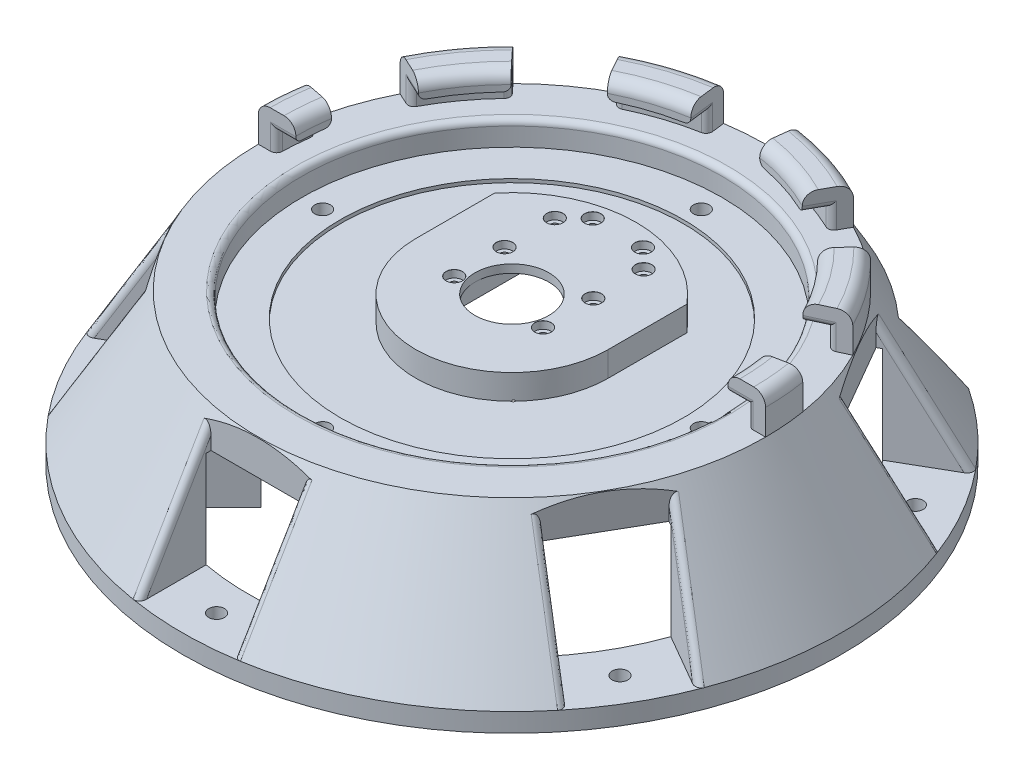
from build123d import *

# Parameters (mm, degrees)
SKETCH2_R                       = 12.5
CUT_EXTRUDE1_DEPTH              = 171.457229262
SKETCH3_R                       = 71
CUT_EXTRUDE2_DEPTH              = 8.2
CUT_EXTRUDE5_DEPTH              = 39
SKETCH8_W                       = 31.75
SKETCH8_H                       = 38.1
CUT_EXTRUDE6_DEPTH              = 44.45
CIRPATTERN2_COUNT               = 6
SKETCH9_R                       = 2.649982
CUT_EXTRUDE7_DEPTH              = 171.457229262
CIRPATTERN3_COUNT               = 6
REVOLVE2_ANGLE                  = 180
CUT_EXTRUDE9_DEPTH              = 12.7
SKETCH3_3_R                     = 12.5
CUT_EXTRUDE11_DEPTH             = 1
CBORE_FOR_M2_5_SHCS1_AT_2_COUNT = 2
CBORE_FOR_M2_5_SHCS1_AT_2_PITCH = 17
CBORE_FOR_M2_5_SHCS1_AT_3_COUNT = 2
CBORE_FOR_M2_5_SHCS1_AT_3_PITCH = 34
CBORE_FOR_M2_5_SHCS1_AT_4_COUNT = 2
CBORE_FOR_M2_5_SHCS1_AT_4_PITCH = 40.820828017
CBORE_FOR_M2_5_SHCS1_AT_5_COUNT = 2
CBORE_FOR_M2_5_SHCS1_AT_5_PITCH = 46.651259361
CBORE_FOR_M2_5_SHCS1_AT_6_COUNT = 2
CBORE_FOR_M2_5_SHCS1_AT_6_PITCH = 45.343136195
CBORE_FOR_M2_5_SHCS1_AT_7_COUNT = 2
CBORE_FOR_M2_5_SHCS1_AT_7_PITCH = 34.481879299
CBORE_FOR_M2_5_SHCS1_AT_8_COUNT = 2
CBORE_FOR_M2_5_SHCS1_AT_8_PITCH = 30
FILLET1_R                       = 4
FILLET2_R                       = 2
FILLET3_R                       = 2
FILLET4_R                       = 2
FILLET5_R                       = 2
FILLET9_R                       = 1
CUT_EXTRUDE12_DEPTH             = 8.05
CUT_EXTRUDE15_START             = -2.75
SKETCH20_R                      = 1.45
CUT_EXTRUDE15_DEPTH             = 2.75
M5_CLEARANCE_HOLE1_D            = 5.3
SKETCH34_R                      = 58
CUT_EXTRUDE16_DEPTH             = 1.2
BOSS_EXTRUDE1_DEPTH             = 39
FILLET10_R                      = 10
SKETCH37_R                      = 121.388219465
SKETCH37_R_2                    = 111.388219465
CUT_EXTRUDE_THIN1_DEPTH         = 171.457229427


with BuildPart() as part:
    # Sketch1 → Revolve1 (revolve)
    with BuildSketch(Plane.XY, mode=Mode.PRIVATE) as revolve1_sk:
        Polygon((0, 0), (-85.725, 0), (-115.054393675, -50.8), (0, -50.8), align=None)
    revolve(revolve1_sk.sketch.rotate(Axis((0, 0, 0), (0, -1, 0)), 270), axis=Axis((0, 0, 0), (0, -1, 0)))

    # Sketch2 → Cut-Extrude1 (cut, through all)
    with BuildSketch(Plane(origin=(0, 0, 0), x_dir=(1, 0, 0), z_dir=(0, 1, 0))):
        with Locations(Location((0, 0, 0), (0, 0, 270))):
            Circle(SKETCH2_R)
    extrude(amount=-CUT_EXTRUDE1_DEPTH, mode=Mode.SUBTRACT)

    # Sketch3 → Cut-Extrude2 (cut)
    with BuildSketch(Plane(origin=(0, 0, 0), x_dir=(1, 0, 0), z_dir=(0, 1, 0))):
        with Locations(Location((0, 0, 0), (0, 0, 270))):
            Circle(SKETCH3_R)
        with BuildLine():
            ThreePointArc((32.5, 0), (0, -32.5), (-32.5, 0))
            Line((-32.5, 0), (-32.5, 26.603571189))
            ThreePointArc((-32.5, 26.603571189), (0, 42), (32.5, 26.603571189))
            Line((32.5, 26.603571189), (32.5, 0))
        make_face(mode=Mode.SUBTRACT)
    extrude(amount=-CUT_EXTRUDE2_DEPTH, mode=Mode.SUBTRACT)

    # Sketch7 → Cut-Extrude5 (cut)
    with BuildSketch(Plane.XZ.offset(50.8)):
        with BuildLine():
            Line((-60, -65.598856697), (-60, -161.1))
            Line((-60, -161.1), (60, -161.1))
            Line((60, -161.1), (60, -65.598856697))
            ThreePointArc((60, -65.598856697), (0, 88.9), (-60, -65.598856697))
        make_face()
    extrude(amount=-CUT_EXTRUDE5_DEPTH, mode=Mode.SUBTRACT)

    # Sketch8 → Cut-Extrude6 (cut)
    with BuildSketch(Plane(origin=(0, 0, 0), x_dir=(1, 0, 0), z_dir=(0, 1, 0))):
        with Locations((0, -104.875)):
            Rectangle(SKETCH8_W, SKETCH8_H)
    cut_extrude6 = extrude(amount=-CUT_EXTRUDE6_DEPTH, mode=Mode.SUBTRACT)

    # CirPattern2: Cut-Extrude6 ×6 about axis, 1 skipped
    cirpattern2_axis = Axis((0, 0, 0), (0, -1, 0))
    add([cut_extrude6.rotate(cirpattern2_axis, i * 360 / CIRPATTERN2_COUNT) for i in range(1, CIRPATTERN2_COUNT) if i not in (3,)], mode=Mode.SUBTRACT)

    # Sketch9 → Cut-Extrude7 (cut, through all)
    with BuildSketch(Plane(origin=(0, 0, 0), x_dir=(1, 0, 0), z_dir=(0, 1, 0))):
        with Locations(Location((0, -99.814393675, 0), (0, 0, 270))):
            Circle(SKETCH9_R)
    cut_extrude7 = extrude(amount=-CUT_EXTRUDE7_DEPTH, mode=Mode.SUBTRACT)

    # CirPattern3: Cut-Extrude7 ×6 about axis
    cirpattern3_axis = Axis((0, 0, 0), (0, 1, 0))
    for i in range(1, CIRPATTERN3_COUNT):
        add(cut_extrude7.rotate(cirpattern3_axis, i * 360 / CIRPATTERN3_COUNT), mode=Mode.SUBTRACT)

    # Sketch12 → Revolve2 (revolve)
    with BuildSketch(Plane.XY):
        Polygon((85.725, 0), (85.725, 12.7), (73.025, 12.7), (73.025, 6.55), (79.575, 6.55), (79.575, 0), align=None)
    revolve(axis=Axis((0, 0, 0), (0, 1, 0)), revolution_arc=REVOLVE2_ANGLE)

    # Sketch18 → Cut-Extrude9 (cut)
    with BuildSketch(Plane(origin=(0, 12.7, 0), x_dir=(1, 0, 0), z_dir=(0, 1, 0))):
        Polygon((46.643270314, 89.718478222), (70.913780145, 72.084920653), (36.670415564, 35.160782448), (22.108109665, 45.740916989), align=None)
        Polygon((-15, 100), (-9, 50), (9, 50), (15, 100), align=None)
        Polygon((90.470396714, 45.167547182), (99.740906545, 16.635851693), (50.333978764, 6.891341072), (44.771672865, 24.010358365), align=None)
        Polygon((99.740906545, -16.635851693), (90.470396714, -45.167547182), (44.771672865, -24.010358365), (50.333978764, -6.891341072), align=None)
        Polygon((70.913780145, -72.084920653), (46.643270314, -89.718478222), (22.108109665, -45.740916989), (36.670415564, -35.160782448), align=None)
        Polygon((15, -100), (-15, -100), (-9, -50), (9, -50), align=None)
        Polygon((-46.643270314, -89.718478222), (-70.913780145, -72.084920653), (-36.670415564, -35.160782448), (-22.108109665, -45.740916989), align=None)
        Polygon((-90.470396714, -45.167547182), (-99.740906545, -16.635851693), (-50.333978764, -6.891341072), (-44.771672865, -24.010358365), align=None)
        Polygon((-99.740906545, 16.635851693), (-90.470396714, 45.167547182), (-44.771672865, 24.010358365), (-50.333978764, 6.891341072), align=None)
        Polygon((-70.913780145, 72.084920653), (-46.643270314, 89.718478222), (-22.108109665, 45.740916989), (-36.670415564, 35.160782448), align=None)
    extrude(amount=-CUT_EXTRUDE9_DEPTH, mode=Mode.SUBTRACT)

    # Sketch3<3> → Cut-Extrude11 (cut)
    # profile 1 of 5: a face of its own
    with BuildSketch(Plane(origin=(0, 0, 0), x_dir=(1, 0, 0), z_dir=(0, 1, 0))):
        with BuildLine():
            ThreePointArc((-18.668154703, 26.603571189), (-28.835438507, 14.992247533), (-32.5, 0))
            ThreePointArc((-32.5, 0), (0, -32.5), (32.5, 0))
            ThreePointArc((32.5, 0), (28.835438507, 14.992247533), (18.668154703, 26.603571189))
            Line((18.668154703, 26.603571189), (-18.668154703, 26.603571189))
        make_face()
        with Locations(Location((0, 0, 0), (0, 0, 270))):
            Circle(SKETCH3_3_R, mode=Mode.SUBTRACT)
    # profile 2 of 5: a face of its own
    with BuildSketch(Plane(origin=(0, 0, 0), x_dir=(1, 0, 0), z_dir=(0, 1, 0))):
        with BuildLine():
            Line((-32.5, 26.603571189), (-32.5, 0))
            ThreePointArc((-32.5, 0), (-28.835438507, 14.992247533), (-18.668154703, 26.603571189))
            Line((-18.668154703, 26.603571189), (-32.5, 26.603571189))
        make_face()
    # profile 3 of 5: a face of its own
    with BuildSketch(Plane(origin=(0, 0, 0), x_dir=(1, 0, 0), z_dir=(0, 1, 0))):
        with BuildLine():
            ThreePointArc((18.668154703, 26.603571189), (0, 32.5), (-18.668154703, 26.603571189))
            Line((-18.668154703, 26.603571189), (18.668154703, 26.603571189))
        make_face()
    # profile 4 of 5: a face of its own
    with BuildSketch(Plane(origin=(0, 0, 0), x_dir=(1, 0, 0), z_dir=(0, 1, 0))):
        with BuildLine():
            ThreePointArc((32.5, 26.603571189), (0, 42), (-32.5, 26.603571189))
            Line((-32.5, 26.603571189), (-18.668154703, 26.603571189))
            ThreePointArc((-18.668154703, 26.603571189), (0, 32.5), (18.668154703, 26.603571189))
            Line((18.668154703, 26.603571189), (32.5, 26.603571189))
        make_face()
    # profile 5 of 5: a face of its own
    with BuildSketch(Plane(origin=(0, 0, 0), x_dir=(1, 0, 0), z_dir=(0, 1, 0))):
        with BuildLine():
            ThreePointArc((18.668154703, 26.603571189), (28.835438507, 14.992247533), (32.5, 0))
            Line((32.5, 0), (32.5, 26.603571189))
            Line((32.5, 26.603571189), (18.668154703, 26.603571189))
        make_face()
    extrude(amount=-CUT_EXTRUDE11_DEPTH, mode=Mode.SUBTRACT)

    # Sketch24 → CBORE for M2.5 SHCS1 (revolve, cut)
    with BuildSketch(Plane(origin=(-15, -1, 4.5), x_dir=(0, 0, 1), z_dir=(1, 0, 0))):
        Polygon((0, 0), (0, 49.8), (1.45, 49.8), (1.45, 2.5), (2.75, 2.5), (2.75, 0.025), (2.775, 0), align=None)
    cbore_for_m2_5_shcs1 = revolve(axis=Axis((-15, 5.35, 4.5), (0, -1, 0)), mode=Mode.SUBTRACT)

    # CBORE for M2.5 SHCS1 at 2: CBORE for M2.5 SHCS1 ×2
    with Locations(*[(0, 0, -i * CBORE_FOR_M2_5_SHCS1_AT_2_PITCH) for i in range(1, CBORE_FOR_M2_5_SHCS1_AT_2_COUNT)]):
        add(cbore_for_m2_5_shcs1, mode=Mode.SUBTRACT)

    # CBORE for M2.5 SHCS1 at 3: CBORE for M2.5 SHCS1 ×2
    with Locations(*[(0, 0, -i * CBORE_FOR_M2_5_SHCS1_AT_3_PITCH) for i in range(1, CBORE_FOR_M2_5_SHCS1_AT_3_COUNT)]):
        add(cbore_for_m2_5_shcs1, mode=Mode.SUBTRACT)

    # CBORE for M2.5 SHCS1 at 4: CBORE for M2.5 SHCS1 ×2
    with Locations(*[Vector(0.15923243882462063, 0, -0.9872411207126472) * (i * CBORE_FOR_M2_5_SHCS1_AT_4_PITCH) for i in range(1, CBORE_FOR_M2_5_SHCS1_AT_4_COUNT)]):
        add(cbore_for_m2_5_shcs1, mode=Mode.SUBTRACT)

    # CBORE for M2.5 SHCS1 at 5: CBORE for M2.5 SHCS1 ×2
    with Locations(*[Vector(0.5037377408822789, 0, -0.8638566364917376) * (i * CBORE_FOR_M2_5_SHCS1_AT_5_PITCH) for i in range(1, CBORE_FOR_M2_5_SHCS1_AT_5_COUNT)]):
        add(cbore_for_m2_5_shcs1, mode=Mode.SUBTRACT)

    # CBORE for M2.5 SHCS1 at 6: CBORE for M2.5 SHCS1 ×2
    with Locations(*[Vector(0.6616216370868465, 0, -0.7498378553650925) * (i * CBORE_FOR_M2_5_SHCS1_AT_6_PITCH) for i in range(1, CBORE_FOR_M2_5_SHCS1_AT_6_COUNT)]):
        add(cbore_for_m2_5_shcs1, mode=Mode.SUBTRACT)

    # CBORE for M2.5 SHCS1 at 7: CBORE for M2.5 SHCS1 ×2
    with Locations(*[Vector(0.8700221858486125, 0, -0.4930125719808802) * (i * CBORE_FOR_M2_5_SHCS1_AT_7_PITCH) for i in range(1, CBORE_FOR_M2_5_SHCS1_AT_7_COUNT)]):
        add(cbore_for_m2_5_shcs1, mode=Mode.SUBTRACT)

    # CBORE for M2.5 SHCS1 at 8: CBORE for M2.5 SHCS1 ×2
    with Locations(*[(i * CBORE_FOR_M2_5_SHCS1_AT_8_PITCH, 0, 0) for i in range(1, CBORE_FOR_M2_5_SHCS1_AT_8_COUNT)]):
        add(cbore_for_m2_5_shcs1, mode=Mode.SUBTRACT)

    # Fillet1
    fillet1_edges = [part.edges().sort_by_distance(p)[0] for p in [
        (-85.450905057, 12.7, -6.849704366),
        (-72.808821363, 12.7, -5.614815819),
        (-59.078466014, 12.7, -42.923018049),
        (-22.565966014, 12.7, -69.450902102),
        (22.565966014, 12.7, -69.450902102),
        (59.078466014, 12.7, -42.923018049),
        (72.808821363, 12.7, -5.614815819),
        (-69.352981843, 12.7, -50.387890753),
        (-26.490481843, 12.7, -81.529319859),
        (26.490481843, 12.7, -81.529319859),
        (69.352981843, 12.7, -50.387890753),
        (85.450905057, 12.7, -6.849704365),
    ]]
    fillet(fillet1_edges, radius=FILLET1_R)

    # Fillet2
    fillet2_edges = [part.edges().sort_by_distance(p)[0] for p in [
        (-76.3, 6.55, 0),
        (76.3, 6.55, 0),
        (67.935220856, 6.55, -34.734411845),
        (75.377123218, 6.55, -11.830591458),
        (34.544373159, 6.55, -68.032050402),
        (54.027526486, 6.55, -53.876710931),
        (-75.377123218, 6.55, -11.830591458),
        (-67.935220856, 6.55, -34.734411845),
        (-54.027526486, 6.55, -53.876710931),
        (-34.544373159, 6.55, -68.032050402),
        (12.041250964, 6.55, -75.34375803),
        (-12.041250964, 6.55, -75.34375803),
    ]]
    fillet(fillet2_edges, radius=FILLET2_R)

    # Fillet3
    fillet3_edges = [part.edges().sort_by_distance(p)[0] for p in [
        (-78.59268106, 4.275, -12.464794776),
        (-56.256192069, 4.275, -56.279849671),
        (-70.909437153, 4.275, -36.11138806),
        (-12.431749785, 4.275, -78.597914872),
        (56.256192069, 4.275, -56.279849671),
        (78.59268106, 4.275, -12.464794776),
        (-79.575, 4.275, 0),
        (-36.141198377, 4.275, -70.894248038),
        (12.431749785, 4.275, -78.597914872),
        (36.141198377, 4.275, -70.894248038),
        (70.909437153, 4.275, -36.11138806),
        (79.575, 4.275, 0),
    ]]
    fillet(fillet3_edges, radius=FILLET3_R)

    # Fillet4
    fillet4_edges = [part.edges().sort_by_distance(p)[0] for p in [
        (92.853698409, -23.56380487, 35.278236725),
        (76.978698409, -23.56380487, 62.774543295),
        (76.978698409, -23.56380487, -62.774543295),
        (92.853698409, -23.56380487, -35.278236725),
        (-92.853698409, -23.56380487, -35.278236725),
        (-76.978698409, -23.56380487, -62.774543295),
        (-76.978698409, -23.56380487, 62.774543295),
        (-92.853698409, -23.56380487, 35.278236725),
        (15.875, -23.56380487, 98.05278002),
        (-15.875, -23.56380487, 98.05278002),
    ]]
    fillet(fillet4_edges, radius=FILLET4_R)

    # Fillet5
    fillet5_edges = [part.edges().sort_by_distance(p)[0] for p in [
        (0, 0, -71),
    ]]
    fillet(fillet5_edges, radius=FILLET5_R)

    # Fillet9
    fillet9_edges = [part.edges().sort_by_distance(p)[0] for p in [
        (-60, -31.116866881, -84.56763471),
        (60, -31.116866881, -84.56763471),
    ]]
    fillet(fillet9_edges, radius=FILLET9_R)

    # Sketch28 → Cut-Extrude12 (cut)
    with BuildSketch(Plane.XZ.offset(11.8)):
        with BuildLine():
            Line((9.2, 12.5), (-9.2, 12.5))
            ThreePointArc((-9.2, 12.5), (-11.674873734, 11.474873734), (-12.7, 9))
            Line((-12.7, 9), (-12.7, -30))
            ThreePointArc((-12.7, -30), (-11.674873734, -32.474873734), (-9.2, -33.5))
            Line((-9.2, -33.5), (9.2, -33.5))
            ThreePointArc((9.2, -33.5), (11.674873734, -32.474873734), (12.7, -30))
            Line((12.7, -30), (12.7, 9))
            ThreePointArc((12.7, 9), (11.674873734, 11.474873734), (9.2, 12.5))
        make_face()
    extrude(amount=-CUT_EXTRUDE12_DEPTH, mode=Mode.SUBTRACT)

    # Sketch20 → Cut-Extrude15 (cut)
    with BuildSketch(Plane.XZ.offset(11.8).offset(CUT_EXTRUDE15_START)):
        Polygon((-22.5, 23), (-22.5, -33), (-12.5, -40), (13.5, -40), (23.5, -33), (23.5, 23), align=None)
        with Locations(Location((-15, -29.5, 0), (0, 0, 90))):
            Circle(SKETCH20_R, mode=Mode.SUBTRACT)
        with Locations(Location((-8.5, -35.8, 0), (0, 0, 90))):
            Circle(SKETCH20_R, mode=Mode.SUBTRACT)
        with Locations(Location((-15, -12.5, 0), (0, 0, 90))):
            Circle(SKETCH20_R, mode=Mode.SUBTRACT)
        with Locations(Location((8.5, -35.8, 0), (0, 0, 90))):
            Circle(SKETCH20_R, mode=Mode.SUBTRACT)
        with Locations(Location((15, -29.5, 0), (0, 0, 90))):
            Circle(SKETCH20_R, mode=Mode.SUBTRACT)
        with BuildLine():
            ThreePointArc((-12.7, 9), (-11.674873734, 11.474873734), (-9.2, 12.5))
            Line((-9.2, 12.5), (9.2, 12.5))
            ThreePointArc((9.2, 12.5), (11.674873734, 11.474873734), (12.7, 9))
            Line((12.7, 9), (12.7, -30))
            ThreePointArc((12.7, -30), (11.674873734, -32.474873734), (9.2, -33.5))
            Line((9.2, -33.5), (-9.2, -33.5))
            ThreePointArc((-9.2, -33.5), (-11.674873734, -32.474873734), (-12.7, -30))
            Line((-12.7, -30), (-12.7, 9))
        make_face(mode=Mode.SUBTRACT)
        with Locations(Location((15, -12.5, 0), (0, 0, 90))):
            Circle(SKETCH20_R, mode=Mode.SUBTRACT)
        with Locations(Location((-15, 4.5, 0), (0, 0, 90))):
            Circle(SKETCH20_R, mode=Mode.SUBTRACT)
        with Locations(Location((15, 4.5, 0), (0, 0, 90))):
            Circle(SKETCH20_R, mode=Mode.SUBTRACT)
    extrude(amount=CUT_EXTRUDE15_DEPTH, mode=Mode.SUBTRACT)

    # M5 Clearance Hole1 (through all)
    with Locations(Plane(origin=(0, -8.2, 0), x_dir=(1, 0, 0), z_dir=(0, 1, 0))):
        with Locations((0, 64), (64, 0), (0, -64), (-64, 0)):
            Hole(M5_CLEARANCE_HOLE1_D / 2)

    # Sketch34 → Cut-Extrude16 (cut)
    with BuildSketch(Plane(origin=(0, -8.2, 0), x_dir=(1, 0, 0), z_dir=(0, 1, 0))):
        with Locations(Location((0, 0, 0), (0, 0, 270))):
            Circle(SKETCH34_R)
        with BuildLine():
            ThreePointArc((32.5, 0), (0, -32.5), (-32.5, 0))
            Line((-32.5, 0), (-32.5, 26.603571189))
            ThreePointArc((-32.5, 26.603571189), (0, 42), (32.5, 26.603571189))
            Line((32.5, 26.603571189), (32.5, 0))
        make_face(mode=Mode.SUBTRACT)
    extrude(amount=-CUT_EXTRUDE16_DEPTH, mode=Mode.SUBTRACT)

    # Sketch39 → Boss-Extrude1 (add)
    with BuildSketch(Plane.XZ.offset(50.8)):
        with BuildLine():
            ThreePointArc((-48.831845645, 74.287689767), (-56.138266806, 68.932612021), (-62.861792847, 62.861792847))
            Line((-62.861792847, 62.861792847), (-42.426406871, 42.426406871))
            Line((-42.426406871, 42.426406871), (-29.69848481, 55.154328933))
            Line((-29.69848481, 55.154328933), (-48.831845645, 74.287689767))
        make_face()
        with BuildLine():
            Line((-72, 12.5), (-88.016816575, 12.5))
            ThreePointArc((-88.016816575, 12.5), (-88.9, 0), (-88.016816575, -12.5))
            Line((-88.016816575, -12.5), (-72, -12.5))
            Line((-72, -12.5), (-72, 12.5))
        make_face()
        with BuildLine():
            ThreePointArc((62.861792847, 62.861792847), (56.138266806, 68.932612021), (48.831845645, 74.287689767))
            Line((48.831845645, 74.287689767), (29.69848481, 55.154328933))
            Line((29.69848481, 55.154328933), (42.426406871, 42.426406871))
            Line((42.426406871, 42.426406871), (62.861792847, 62.861792847))
        make_face()
        with BuildLine():
            ThreePointArc((88.016816575, -12.5), (88.9, 0), (88.016816575, 12.5))
            Line((88.016816575, 12.5), (72, 12.5))
            Line((72, 12.5), (72, -12.5))
            Line((72, -12.5), (88.016816575, -12.5))
        make_face()
    extrude(amount=-BOSS_EXTRUDE1_DEPTH)

    # Fillet10
    fillet10_edges = [part.edges().sort_by_distance(p)[0] for p in [
        (-36.062445841, -11.8, 48.790367902),
        (36.062445841, -11.8, 48.790367902),
    ]]
    fillet(fillet10_edges, radius=FILLET10_R)

    # Sketch37 → Cut-Extrude-Thin1 (cut, through all)
    with BuildSketch(Plane(origin=(0, 0, 0), x_dir=(1, 0, 0), z_dir=(0, 1, 0))):
        Circle(SKETCH37_R)
        Circle(SKETCH37_R_2, mode=Mode.SUBTRACT)
    extrude(amount=-CUT_EXTRUDE_THIN1_DEPTH, mode=Mode.SUBTRACT)


solid = part.part
